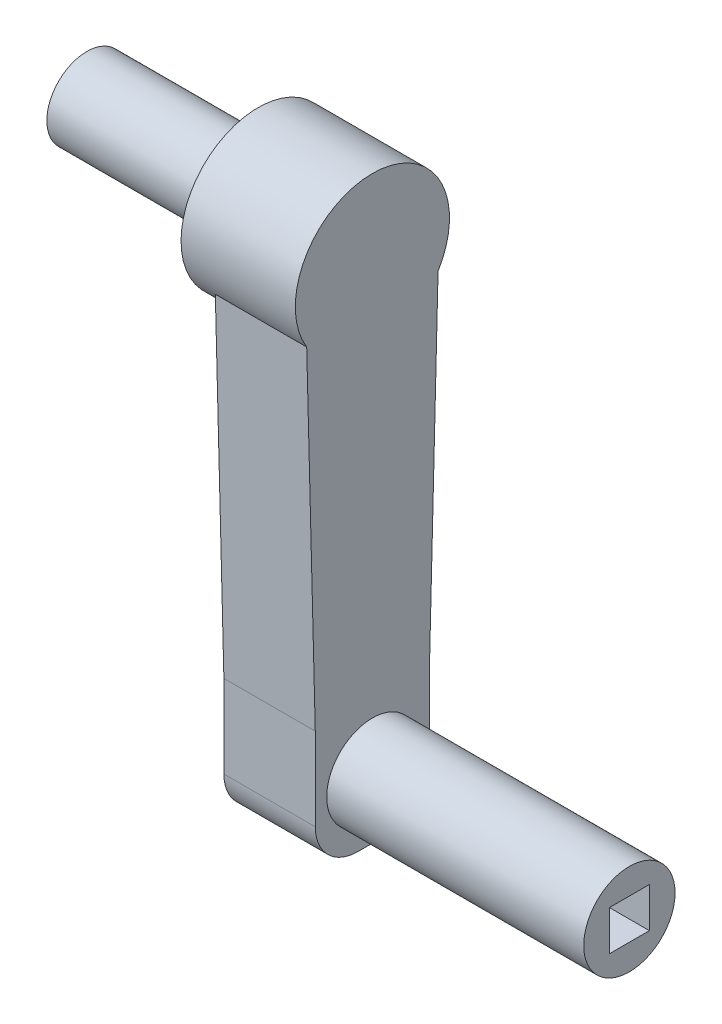
from build123d import *

# Parameters (mm, degrees)
ESQUISSE1_R             = 80
BOSS_EXTRU_1_DEPTH      = 200
BOSS_EXTRU_3_DEPTH      = 650
ESQUISSE4_W             = 70
ESQUISSE4_H             = 70
ENL_V_MAT_EXTRU_4_DEPTH = 100
ESQUISSE1_6_R           = 70
BOSS_EXTRU_4_DEPTH      = 300
CHANFREIN1_SIZE         = 40


with BuildPart() as part:
    # Esquisse1 → Boss.-Extru.1 (new body)
    with BuildSketch(Plane(origin=(0, 0, 0), x_dir=(0, 0, -1), z_dir=(1, 0, 0))):
        with BuildLine():
            ThreePointArc((115, -70.710678119), (0, 135), (-115, -70.710678119))
            Line((-115, -70.710678119), (-100, -660.710678119))
            Line((-100, -660.710678119), (-100, -805.710678119))
            ThreePointArc((-100, -805.710678119), (-78.033008589, -858.743686708), (-25, -880.710678119))
            Line((-25, -880.710678119), (25, -880.710678119))
            ThreePointArc((25, -880.710678119), (78.033008589, -858.743686708), (100, -805.710678119))
            Line((100, -805.710678119), (100, -660.710678119))
            Line((100, -660.710678119), (115, -70.710678119))
        make_face()
        with Locations((0, -770.710678119)):
            Circle(ESQUISSE1_R, mode=Mode.SUBTRACT)
    extrude(amount=BOSS_EXTRU_1_DEPTH)

    # Esquisse1<5> → Boss.-Extru.3 (add)
    with BuildSketch(Plane(origin=(0, 0, 0), x_dir=(0, 0, -1), z_dir=(1, 0, 0))):
        with BuildLine():
            ThreePointArc((80, -770.710678119), (0, -690.710678119), (-80, -770.710678119))
            Line((-80, -770.710678119), (80, -770.710678119))
        make_face()
        with BuildLine():
            Line((80, -770.710678119), (-80, -770.710678119))
            ThreePointArc((-80, -770.710678119), (0, -850.710678119), (80, -770.710678119))
        make_face()
    extrude(amount=BOSS_EXTRU_3_DEPTH)

    # Esquisse4 → Enlèv. mat.-Extru.4 (cut)
    with BuildSketch(Plane(origin=(650, 0, 0), x_dir=(0, 0, -1), z_dir=(1, 0, 0))):
        with Locations((0, -770.710678119)):
            Rectangle(ESQUISSE4_W, ESQUISSE4_H)
    extrude(amount=-ENL_V_MAT_EXTRU_4_DEPTH, mode=Mode.SUBTRACT)

    # Chanfrein1
    # the kernel refuses this chamfer: 40 mm, written as the material it takes off along each edge
    with BuildSketch(Plane(origin=(0, -805.710678119, -25), x_dir=(0, -1, 0), z_dir=(0, 0, 1))) as chanfrein1_piece_1:
        Polygon((75, CHANFREIN1_SIZE), (75 - CHANFREIN1_SIZE, 0), (75, 0), align=None)
    revolve(axis=Axis((0, -805.710678119, -25), (1, 0, 0)), revolution_arc=90, mode=Mode.SUBTRACT)
    with BuildSketch(Plane(origin=(0, -880.710678119, 25), x_dir=(0, 1, 0), z_dir=(0, 0, -1))) as chanfrein1_piece_2:
        Polygon((CHANFREIN1_SIZE, 0), (0, CHANFREIN1_SIZE), (0, 0), align=None)
    extrude(amount=50, mode=Mode.SUBTRACT)
    with BuildSketch(Plane(origin=(0, -805.710678119, 25), x_dir=(0, 0, 1), z_dir=(0, 1, 0))) as chanfrein1_piece_3:
        Polygon((75 - CHANFREIN1_SIZE, 0), (75, CHANFREIN1_SIZE), (75, 0), align=None)
    revolve(axis=Axis((0, -805.710678119, 25), (1, 0, 0)), revolution_arc=90, mode=Mode.SUBTRACT)
    with BuildSketch(Plane(origin=(0, -557.8433586, 100), x_dir=(0, 0, -1), z_dir=(0, -1, 0))) as chanfrein1_piece_4_section:
        Polygon((CHANFREIN1_SIZE, 0), (0, CHANFREIN1_SIZE), (0, 0), align=None)
    chanfrein1_piece_4 = extrude(amount=247.867319519, mode=Mode.PRIVATE)
    chanfrein1_piece_4 = split(chanfrein1_piece_4, bisect_by=Plane(origin=(18.692786983, -557.368271768, 81.313251281), z_dir=(-0.7071067811865477, -0.01797148390738359, 0.7068783670237524)), keep=Keep.TOP, mode=Mode.PRIVATE)
    add(chanfrein1_piece_4, mode=Mode.SUBTRACT)
    with BuildSketch(Plane(origin=(0, 32.123412539, 117.614426034), x_dir=(0, 0.025415516277791695, -0.999676973593137), z_dir=(0, -0.9996769735931369, -0.02541551627779169))) as chanfrein1_piece_5_section:
        Polygon((CHANFREIN1_SIZE, 0), (0, CHANFREIN1_SIZE), (0, 0), align=None)
    chanfrein1_piece_5 = extrude(amount=795.925286201, mode=Mode.PRIVATE)
    chanfrein1_piece_5 = chanfrein1_piece_5 - Plane(origin=(0, 0, 0), x_dir=(0, -0.5237828008789241, -0.851851851851852), z_dir=(-1, 0, 0)) * Cylinder(135, 1752, mode=Mode.PRIVATE)
    chanfrein1_piece_5 = split(chanfrein1_piece_5, bisect_by=Plane(origin=(28.807213017, 32.123412539, 88.807213017), z_dir=(-0.7071067811865476, 0, 0.7071067811865476)), keep=Keep.TOP, mode=Mode.PRIVATE)
    add(chanfrein1_piece_5, mode=Mode.SUBTRACT)
    with BuildSketch(Plane(origin=(0, -763.544768777, -97.385573966), x_dir=(1, 0, 0), z_dir=(0, 0.9996769735931369, -0.02541551627779147))) as chanfrein1_piece_6_section:
        Polygon((CHANFREIN1_SIZE, 0), (0, -CHANFREIN1_SIZE), (0, 0), align=None)
    chanfrein1_piece_6 = extrude(amount=795.925286201, mode=Mode.PRIVATE)
    chanfrein1_piece_6 = chanfrein1_piece_6 - Plane(origin=(0, 0, 0), x_dir=(0, -0.5237828008789241, -0.851851851851852), z_dir=(-1, 0, 0)) * Cylinder(135, 1752, mode=Mode.PRIVATE)
    chanfrein1_piece_6 = split(chanfrein1_piece_6, bisect_by=Plane(origin=(18.692786983, -763.544768777, -78.692786983), z_dir=(-0.7071067811865476, 0, -0.7071067811865476)), keep=Keep.TOP, mode=Mode.PRIVATE)
    add(chanfrein1_piece_6, mode=Mode.SUBTRACT)
    with BuildSketch(Plane(origin=(0, -805.710678119, -100), x_dir=(1, 0, 0), z_dir=(0, 1, 0))) as chanfrein1_piece_7_section:
        Polygon((CHANFREIN1_SIZE, 0), (0, -CHANFREIN1_SIZE), (0, 0), align=None)
    chanfrein1_piece_7 = extrude(amount=247.867319519, mode=Mode.PRIVATE)
    chanfrein1_piece_7 = split(chanfrein1_piece_7, bisect_by=Plane(origin=(21.84262493, -805.155536529, -78.164430815), z_dir=(-0.7071067811865477, -0.017971483907383432, -0.7068783670237524)), keep=Keep.TOP, mode=Mode.PRIVATE)
    add(chanfrein1_piece_7, mode=Mode.SUBTRACT)


with BuildPart() as body_2:
    # Esquisse1<6> → Boss.-Extru.4 (new body)
    with BuildSketch(Plane(origin=(0, 0, 0), x_dir=(0, 0, -1), z_dir=(1, 0, 0))):
        Circle(ESQUISSE1_6_R)
    extrude(amount=-BOSS_EXTRU_4_DEPTH)


solid = Compound([part.part, body_2.part])
